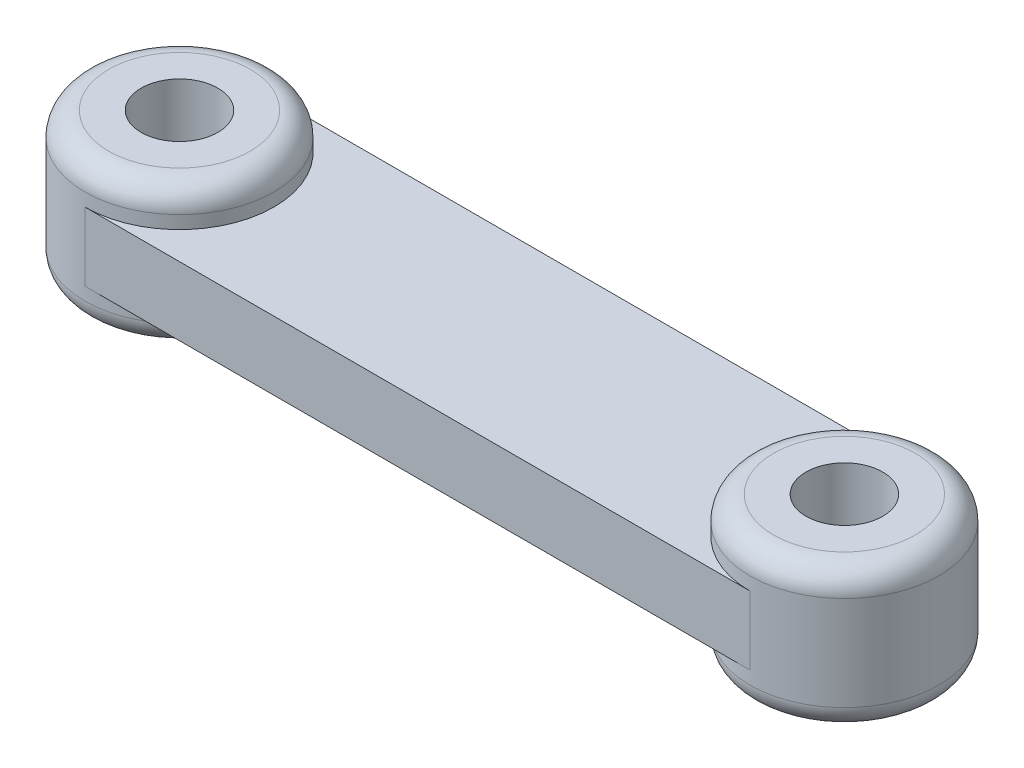
from build123d import *
from build123d.topology import SkipClean

# Parameters (mm, degrees)
BOSS_EXTRUDE1_DEPTH = 1.45
SKETCH2_R           = 4
BOSS_EXTRUDE2_DEPTH = 3
FILLET1_R           = 1
SKETCH3_R           = 1.625
CUT_EXTRUDE1_DEPTH  = 20.460360465


with BuildPart() as part:
    # Sketch1 → Boss-Extrude1 (new, symmetric)
    with BuildSketch(Plane(origin=(0, 0, 0), x_dir=(1, 0, 0), z_dir=(0, 1, 0))):
        with BuildLine():
            Line((-14.075, 4), (14.075, 4))
            ThreePointArc((14.075, 4), (18.075, 0), (14.075, -4))
            Line((14.075, -4), (-14.075, -4))
            ThreePointArc((-14.075, -4), (-18.075, 0), (-14.075, 4))
        make_face()
    extrude(amount=BOSS_EXTRUDE1_DEPTH, both=True)

    # Sketch2 → Boss-Extrude2 (add, symmetric)
    with SkipClean():  # the faces are left unmerged after this step: merging them gives an invalid solid
        with BuildSketch(Plane(origin=(0, 0, 0), x_dir=(1, 0, 0), z_dir=(0, 1, 0))):
            with Locations((-14.075, 0)):
                Circle(SKETCH2_R)
            with Locations((14.075, 0)):
                Circle(SKETCH2_R)
        extrude(amount=BOSS_EXTRUDE2_DEPTH, both=True)
    add(part.part.scale(1), mode=Mode.REPLACE)  # the faces are merged on a copy

    # Fillet1
    fillet1_edges = [part.edges().sort_by_distance(p)[0] for p in [
        (10.075, 3, 0),
        (10.075, -3, 0),
        (-18.075, -3, 0),
        (-18.075, 3, 0),
    ]]
    fillet(fillet1_edges, radius=FILLET1_R)

    # Sketch3 → Cut-Extrude1 (cut, through all)
    with BuildSketch(Plane(origin=(0, 3, 0), x_dir=(1, 0, 0), z_dir=(0, 1, 0))):
        with Locations((-14.075, 0)):
            Circle(SKETCH3_R)
        with Locations((14.075, 0)):
            Circle(SKETCH3_R)
    extrude(amount=-CUT_EXTRUDE1_DEPTH, mode=Mode.SUBTRACT)


solid = part.part
